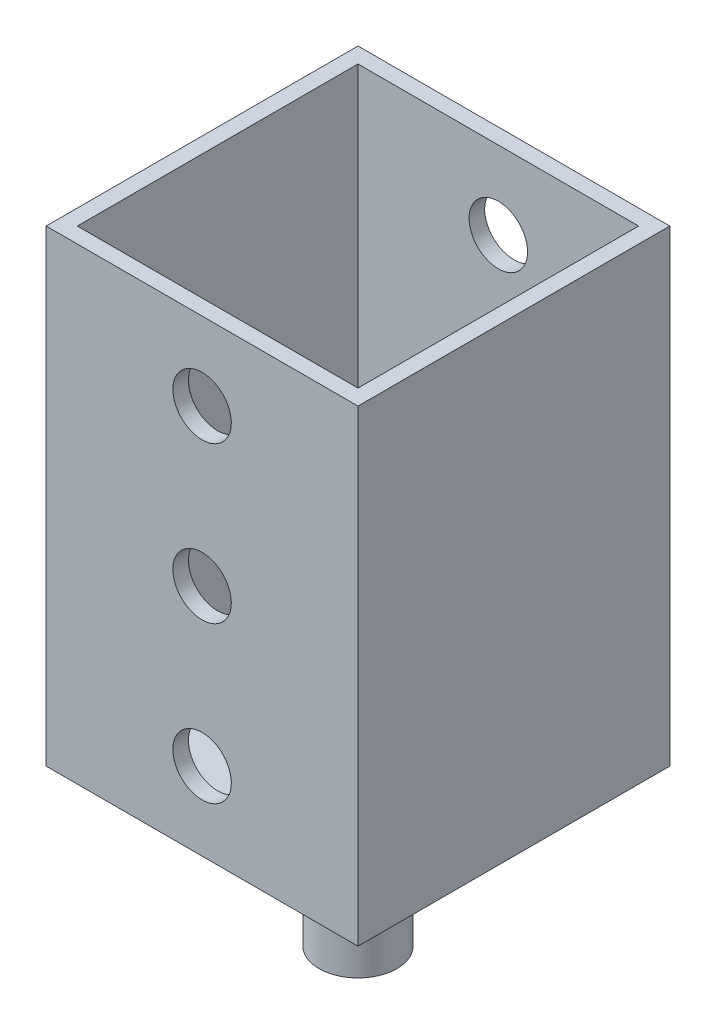
from build123d import *

# Parameters (mm, degrees)
SKETCH1_W           = 50.8
SKETCH1_H           = 76.2
BOSS_EXTRUDE1_DEPTH = 25.4
SKETCH2_R           = 4.7625
SKETCH2_R_2         = 3.175
CUT_EXTRUDE1_DEPTH  = 105.726882891
SKETCH3_W           = 45.72
SKETCH3_H           = 45.72
CUT_EXTRUDE2_DEPTH  = 73.66
SKETCH4_R           = 6.35
BOSS_EXTRUDE2_DEPTH = 25.4


with BuildPart() as part:
    # Sketch1 → Boss-Extrude1 (new, symmetric)
    with BuildSketch(Plane.XY):
        with Locations((25.4, 38.1)):
            Rectangle(SKETCH1_W, SKETCH1_H)
    extrude(amount=BOSS_EXTRUDE1_DEPTH, both=True)

    # Sketch2 → Cut-Extrude1 (cut, through all)
    with BuildSketch(Plane.XY.offset(25.4)):
        with Locations((25.4, 38.1)):
            Circle(SKETCH2_R)
        with Locations((25.4, 63.5)):
            Circle(SKETCH2_R)
        with Locations((25.4, 88.9)):
            Circle(SKETCH2_R_2)
        with Locations((25.4, 12.7)):
            Circle(SKETCH2_R)
    extrude(amount=-CUT_EXTRUDE1_DEPTH, mode=Mode.SUBTRACT)

    # Sketch3 → Cut-Extrude2 (cut)
    with BuildSketch(Plane(origin=(0, 76.2, 0), x_dir=(1, 0, 0), z_dir=(0, 1, 0))):
        with Locations((25.4, 0)):
            Rectangle(SKETCH3_W, SKETCH3_H)
    extrude(amount=-CUT_EXTRUDE2_DEPTH, mode=Mode.SUBTRACT)

    # Sketch4 → Boss-Extrude2 (add)
    with BuildSketch(Plane.XZ):
        with Locations((25.4, 0)):
            Circle(SKETCH4_R)
    extrude(amount=BOSS_EXTRUDE2_DEPTH)


solid = part.part
